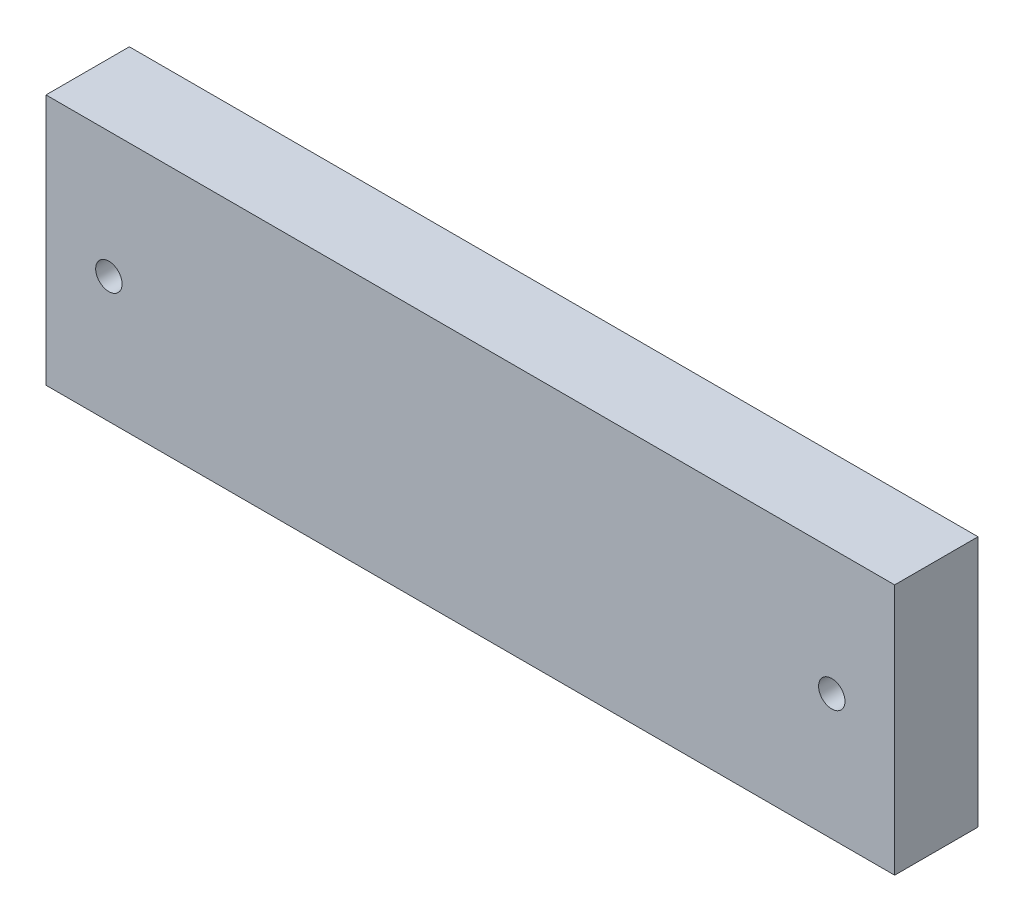
from build123d import *

# Parameters (mm, degrees)
SKETCH1_W             = 135
SKETCH1_H             = 40
BOSS_EXTRUDE1_DEPTH   = 6.63
M5X0_8_TAPPED_HOLE1_D = 4.2


with BuildPart() as part:
    # Sketch1 → Boss-Extrude1 (new, symmetric)
    with BuildSketch(Plane.XY):
        Rectangle(SKETCH1_W, SKETCH1_H)
    extrude(amount=BOSS_EXTRUDE1_DEPTH, both=True)

    # M5x0.8 Tapped Hole1 (through all)
    with Locations(Plane.XY.offset(6.63)):
        with Locations((57.5, 0), (-57.5, 0)):
            Hole(M5X0_8_TAPPED_HOLE1_D / 2)


solid = part.part
